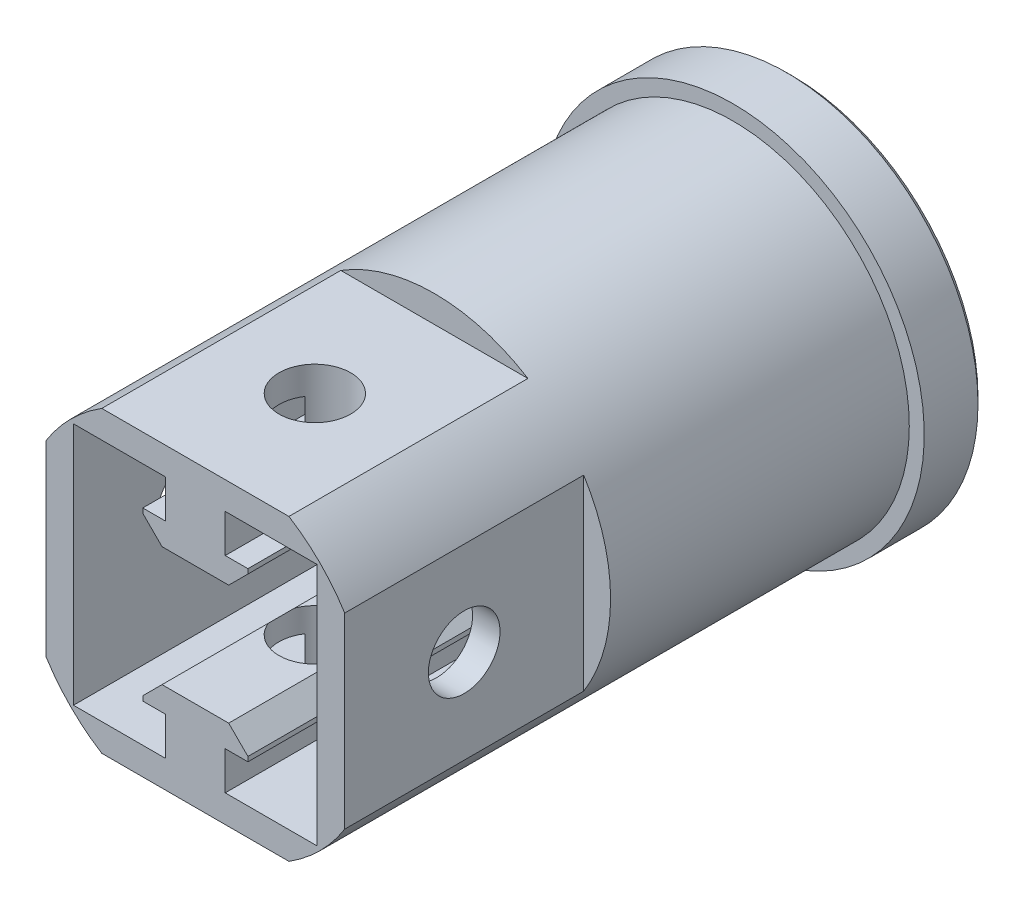
from build123d import *

# Parameters (mm, degrees)
SKETCH1_R           = 14.75
BOSS_EXTRUDE1_DEPTH = 50
SKETCH6_R           = 16
SKETCH6_R_2         = 14.75
BOSS_EXTRUDE4_DEPTH = 5
CUT_EXTRUDE3_DEPTH  = 20
SKETCH8_R           = 3
CUT_EXTRUDE4_DEPTH  = 60.73483071
CHAMFER2_SIZE       = 0.5


with BuildPart() as part:
    # Sketch1 → Boss-Extrude1 (new body)
    with BuildSketch(Plane.XY):
        Circle(SKETCH1_R)
        Polygon((-10.2, 10.2), (-2.5, 10.2), (-2.5, 7), (-4.4, 7), (-4.4, 6.61), (-2.79, 5), (2.79, 5), (4.4, 6.61), (4.4, 7), (2.5, 7), (2.5, 10.2), (10.2, 10.2), (10.2, 2.5), (10.2, -2.5), (10.2, -10.2), (2.5, -10.2), (2.5, -7), (4.4, -7), (4.4, -6.61), (2.79, -5), (-2.79, -5), (-4.4, -6.61), (-4.4, -7), (-2.5, -7), (-2.5, -10.2), (-10.2, -10.2), (-10.2, -2.5), (-10.2, 2.5), align=None, mode=Mode.SUBTRACT)
    extrude(amount=BOSS_EXTRUDE1_DEPTH)

    # Sketch6 → Boss-Extrude4 (add)
    with BuildSketch(Plane(origin=(0, 0, 0), x_dir=(-1, 0, 0), z_dir=(0, 0, -1))):
        Circle(SKETCH6_R)
        Circle(SKETCH6_R_2, mode=Mode.SUBTRACT)
    extrude(amount=-BOSS_EXTRUDE4_DEPTH)

    # Sketch7 → Cut-Extrude3 (cut)
    with BuildSketch(Plane.XY.offset(50)):
        Polygon((0, -12.5), (11.066614126, -12.5), (11.066614126, -16.552961951), (-11.340768707, -16.552961951), (-11.340768707, -12.5), align=None)
        Polygon((-11.340768707, 12.5), (0, 12.5), (11.066614126, 12.5), (11.066614126, 16.552961951), (-11.340768707, 16.552961951), align=None)
        Polygon((12.5, 0), (12.5, 11.066614126), (16.552961951, 11.066614126), (16.552961951, -11.340768707), (12.5, -11.340768707), align=None)
        Polygon((-12.5, -11.340768707), (-12.5, 0), (-12.5, 11.066614126), (-16.552961951, 11.066614126), (-16.552961951, -11.340768707), align=None)
    extrude(amount=-CUT_EXTRUDE3_DEPTH, mode=Mode.SUBTRACT)

    # Sketch8 → Cut-Extrude4 (cut, through all)
    with BuildSketch(Plane.XZ.offset(12.5)):
        with Locations(Location((0, 40, 0), (0, 0, 270))):
            Circle(SKETCH8_R)
    cut_extrude4 = extrude(amount=-CUT_EXTRUDE4_DEPTH, mode=Mode.SUBTRACT)

    # Mirror1: Cut-Extrude4 across plane
    add(cut_extrude4.mirror(Plane(origin=(0, 0, 0), x_dir=(0, 0, 1), z_dir=(0.7071067811865495, -0.7071067811865457, 0))), mode=Mode.SUBTRACT)

    # Chamfer2
    # the kernel refuses this chamfer: 0.5 mm, written as the material it takes off along each edge
    with BuildSketch(Plane(origin=(-5.30922724, 7.51922724, 0), x_dir=(-0.019442520806013736, -0.01944252080601385, 0.9996219169112968), z_dir=(0.7071067811865497, -0.7071067811865455, 0)), Plane(origin=(1.88077276, 4.09077276, 0), x_dir=(0.019442520806013972, -0.01944252080601405, 0.9996219169112968), z_dir=(0.7071067811865489, 0.7071067811865461, 0)), Plane(origin=(5.30922724, -7.51922724, 0), x_dir=(0.019442520806013767, 0.019442520806013813, 0.9996219169112968), z_dir=(-0.7071067811865485, 0.7071067811865467, 0)), Plane(origin=(-1.88077276, -4.09077276, 0), x_dir=(-0.019442520806013986, 0.019442520806014035, 0.9996219169112968), z_dir=(-0.7071067811865485, -0.7071067811865467, 0))) as chamfer2_piece_1:
        Polygon((CHAMFER2_SIZE * 0.999621916911, -CHAMFER2_SIZE * 0.0274958766106), (-CHAMFER2_SIZE * 0.0274958766106, -CHAMFER2_SIZE * 0.999621916911), (0, 0), align=None)
    extrude(amount=4.848566823, mode=Mode.SUBTRACT)
    with BuildSketch(Plane(origin=(-4.075841494, 5, 0), x_dir=(0, 0.9996219169112968, -0.02749587661058639), z_dir=(1, 0, 0)), Plane(origin=(4.075841494, -5, 0), x_dir=(0, -0.9996219169112968, -0.02749587661058639), z_dir=(-1, 0, 0))) as chamfer2_piece_2:
        Polygon((CHAMFER2_SIZE * 0.999621916911, CHAMFER2_SIZE * 0.0274958766106), (-CHAMFER2_SIZE * 0.0274958766106, CHAMFER2_SIZE * 0.999621916911), (0, 0), align=None)
    extrude(amount=8.151682988, mode=Mode.SUBTRACT)
    with BuildSketch(Plane(origin=(5.685841494, 7, 0), x_dir=(0, 0.02749587661058563, 0.9996219169112968), z_dir=(-1, 0, 0)), Plane(origin=(2.5, -7, 0), x_dir=(0, -0.02749587661058563, 0.9996219169112968), z_dir=(1, 0, 0)), Plane(origin=(-5.685841494, -7, 0), x_dir=(0, -0.02749587661058563, 0.9996219169112968), z_dir=(1, 0, 0)), Plane(origin=(-2.5, 7, 0), x_dir=(0, 0.02749587661058563, 0.9996219169112968), z_dir=(-1, 0, 0))) as chamfer2_piece_3:
        Polygon((CHAMFER2_SIZE * 0.999621916911, -CHAMFER2_SIZE * 0.0274958766106), (-CHAMFER2_SIZE * 0.0274958766106, -CHAMFER2_SIZE * 0.999621916911), (0, 0), align=None)
    extrude(amount=3.185841494, mode=Mode.SUBTRACT)
    with BuildSketch(Plane(origin=(2.5, 7, 0), x_dir=(-0.9996219169112968, 2.3583319446590707e-15, -0.027495876610586365), z_dir=(0, 1, 0)), Plane(origin=(2.5, -10.2, 0), x_dir=(-0.9996219169112968, -2.0808811276403563e-15, -0.027495876610586365), z_dir=(0, 1, 0)), Plane(origin=(-2.5, -7, 0), x_dir=(0.9996219169112968, -2.0808811276403563e-15, -0.027495876610586365), z_dir=(0, -1, 0)), Plane(origin=(-2.5, 10.2, 0), x_dir=(0.9996219169112968, -9.19749458417038e-14, -0.027495876610586365), z_dir=(0, -1, 0))) as chamfer2_piece_4:
        Polygon((CHAMFER2_SIZE * 0.999621916911, CHAMFER2_SIZE * 0.0274958766106), (-CHAMFER2_SIZE * 0.0274958766106, CHAMFER2_SIZE * 0.999621916911), (0, 0), align=None)
    extrude(amount=3.2, mode=Mode.SUBTRACT)
    with BuildSketch(Plane(origin=(2.5, 10.2, 0), x_dir=(0, -0.02749587661058563, 0.9996219169112968), z_dir=(1, 0, 0)), Plane(origin=(10.2, -10.2, 0), x_dir=(0, 0.02749587661058563, 0.9996219169112968), z_dir=(-1, 0, 0)), Plane(origin=(-2.5, -10.2, 0), x_dir=(0, 0.02749587661058563, 0.9996219169112968), z_dir=(-1, 0, 0)), Plane(origin=(-10.2, 10.2, 0), x_dir=(0, -0.02749587661058563, 0.9996219169112968), z_dir=(1, 0, 0))) as chamfer2_piece_5:
        Polygon((CHAMFER2_SIZE * 0.999621916911, -CHAMFER2_SIZE * 0.0274958766106), (-CHAMFER2_SIZE * 0.0274958766106, -CHAMFER2_SIZE * 0.999621916911), (0, 0), align=None)
    extrude(amount=7.7, mode=Mode.SUBTRACT)
    with BuildSketch(Plane(origin=(10.2, 10.2, 0), x_dir=(-0.02749587661058563, 0, 0.9996219169112968), z_dir=(0, -1, 0)), Plane(origin=(-10.2, -10.2, 0), x_dir=(0.02749587661058563, 0, 0.9996219169112968), z_dir=(0, 1, 0))) as chamfer2_piece_6:
        Polygon((CHAMFER2_SIZE * 0.999621916911, -CHAMFER2_SIZE * 0.0274958766106), (-CHAMFER2_SIZE * 0.0274958766106, -CHAMFER2_SIZE * 0.999621916911), (0, 0), align=None)
    extrude(amount=20.4, mode=Mode.SUBTRACT)
    with BuildSketch(Plane(origin=(0, 0, 0), x_dir=(-1, 0, 0), z_dir=(0, -1, 0))) as chamfer2_piece_7:
        Polygon((16, -CHAMFER2_SIZE), (16 - CHAMFER2_SIZE, 0), (16, 0), align=None)
    revolve(axis=Axis((0, 0, 0), (0, 0, -1)), mode=Mode.SUBTRACT)
    with BuildSketch(Plane(origin=(5.685841494, 7, 0), x_dir=(0, 0.02749587661058563, 0.9996219169112968), z_dir=(-1, 0, 0))) as chamfer2_piece_8a_section:
        Polygon((CHAMFER2_SIZE * 0.999621916911, -CHAMFER2_SIZE * 0.0274958766106), (-CHAMFER2_SIZE * 0.0274958766106, -CHAMFER2_SIZE * 0.999621916911), (0, 0), align=None)
    chamfer2_piece_8a = extrude(amount=4.471682988, mode=Mode.PRIVATE)
    chamfer2_piece_8a = split(chamfer2_piece_8a, bisect_by=Plane(origin=(2.5, 6.835103187, 0.164896813), z_dir=(-1, 0, 0)), keep=Keep.TOP, mode=Mode.PRIVATE)
    with BuildSketch(Plane(origin=(2.5, 5.714158506, 0), x_dir=(-0.9996219169112968, 2.3583319446590707e-15, -0.027495876610586365), z_dir=(0, 1, 0))) as chamfer2_piece_8b_section:
        Polygon((CHAMFER2_SIZE * 0.999621916911, CHAMFER2_SIZE * 0.0274958766106), (-CHAMFER2_SIZE * 0.0274958766106, CHAMFER2_SIZE * 0.999621916911), (0, 0), align=None)
    chamfer2_piece_8b = extrude(amount=4.485841494, mode=Mode.PRIVATE)
    chamfer2_piece_8b = split(chamfer2_piece_8b, bisect_by=Plane(origin=(2.335103187, 7, 0.164896813), z_dir=(0, -1, 0)), keep=Keep.TOP, mode=Mode.PRIVATE)
    chamfer2_piece_8 = chamfer2_piece_8a & chamfer2_piece_8b
    add(chamfer2_piece_8, mode=Mode.SUBTRACT)
    with BuildSketch(Plane(origin=(1.214158506, 10.2, 0), x_dir=(0, -0.02749587661058563, 0.9996219169112968), z_dir=(1, 0, 0))) as chamfer2_piece_9a_section:
        Polygon((CHAMFER2_SIZE * 0.999621916911, -CHAMFER2_SIZE * 0.0274958766106), (-CHAMFER2_SIZE * 0.0274958766106, -CHAMFER2_SIZE * 0.999621916911), (0, 0), align=None)
    chamfer2_piece_9a = extrude(amount=8.985841494, mode=Mode.PRIVATE)
    chamfer2_piece_9a = split(chamfer2_piece_9a, bisect_by=Plane(origin=(2.5, 10.364896813, 0.164896813), z_dir=(-1, 0, 0)), keep=Keep.TOP, mode=Mode.PRIVATE)
    with BuildSketch(Plane(origin=(2.5, 7, 0), x_dir=(-0.9996219169112968, 2.3583319446590707e-15, -0.027495876610586365), z_dir=(0, 1, 0))) as chamfer2_piece_9b_section:
        Polygon((CHAMFER2_SIZE * 0.999621916911, CHAMFER2_SIZE * 0.0274958766106), (-CHAMFER2_SIZE * 0.0274958766106, CHAMFER2_SIZE * 0.999621916911), (0, 0), align=None)
    chamfer2_piece_9b = extrude(amount=4.485841494, mode=Mode.PRIVATE)
    chamfer2_piece_9b = split(chamfer2_piece_9b, bisect_by=Plane(origin=(2.335103187, 10.2, 0.164896813), z_dir=(0, 1, 0)), keep=Keep.TOP, mode=Mode.PRIVATE)
    chamfer2_piece_9 = chamfer2_piece_9a & chamfer2_piece_9b
    add(chamfer2_piece_9, mode=Mode.SUBTRACT)
    with BuildSketch(Plane(origin=(2.5, 10.2, 0), x_dir=(0, -0.02749587661058563, 0.9996219169112968), z_dir=(1, 0, 0))) as chamfer2_piece_10a_section:
        Polygon((CHAMFER2_SIZE * 0.999621916911, -CHAMFER2_SIZE * 0.0274958766106), (-CHAMFER2_SIZE * 0.0274958766106, -CHAMFER2_SIZE * 0.999621916911), (0, 0), align=None)
    chamfer2_piece_10a = extrude(amount=8.985841494, mode=Mode.PRIVATE)
    chamfer2_piece_10a = split(chamfer2_piece_10a, bisect_by=Plane(origin=(10.2, 10.364896813, 0.164896813), z_dir=(1, 0, 0)), keep=Keep.TOP, mode=Mode.PRIVATE)
    with BuildSketch(Plane(origin=(10.2, 11.485841494, 0), x_dir=(-0.02749587661058563, 0, 0.9996219169112968), z_dir=(0, -1, 0))) as chamfer2_piece_10b_section:
        Polygon((CHAMFER2_SIZE * 0.999621916911, -CHAMFER2_SIZE * 0.0274958766106), (-CHAMFER2_SIZE * 0.0274958766106, -CHAMFER2_SIZE * 0.999621916911), (0, 0), align=None)
    chamfer2_piece_10b = extrude(amount=21.685841494, mode=Mode.PRIVATE)
    chamfer2_piece_10b = split(chamfer2_piece_10b, bisect_by=Plane(origin=(10.364896813, 10.2, 0.164896813), z_dir=(0, 1, 0)), keep=Keep.TOP, mode=Mode.PRIVATE)
    chamfer2_piece_10 = chamfer2_piece_10a & chamfer2_piece_10b
    add(chamfer2_piece_10, mode=Mode.SUBTRACT)
    with BuildSketch(Plane(origin=(10.2, 10.2, 0), x_dir=(-0.02749587661058563, 0, 0.9996219169112968), z_dir=(0, -1, 0))) as chamfer2_piece_11a_section:
        Polygon((CHAMFER2_SIZE * 0.999621916911, -CHAMFER2_SIZE * 0.0274958766106), (-CHAMFER2_SIZE * 0.0274958766106, -CHAMFER2_SIZE * 0.999621916911), (0, 0), align=None)
    chamfer2_piece_11a = extrude(amount=21.685841494, mode=Mode.PRIVATE)
    chamfer2_piece_11a = split(chamfer2_piece_11a, bisect_by=Plane(origin=(10.364896813, -10.2, 0.164896813), z_dir=(0, -1, 0)), keep=Keep.TOP, mode=Mode.PRIVATE)
    with BuildSketch(Plane(origin=(11.485841494, -10.2, 0), x_dir=(0, 0.02749587661058563, 0.9996219169112968), z_dir=(-1, 0, 0))) as chamfer2_piece_11b_section:
        Polygon((CHAMFER2_SIZE * 0.999621916911, -CHAMFER2_SIZE * 0.0274958766106), (-CHAMFER2_SIZE * 0.0274958766106, -CHAMFER2_SIZE * 0.999621916911), (0, 0), align=None)
    chamfer2_piece_11b = extrude(amount=8.985841494, mode=Mode.PRIVATE)
    chamfer2_piece_11b = split(chamfer2_piece_11b, bisect_by=Plane(origin=(10.2, -10.364896813, 0.164896813), z_dir=(1, 0, 0)), keep=Keep.TOP, mode=Mode.PRIVATE)
    chamfer2_piece_11 = chamfer2_piece_11a & chamfer2_piece_11b
    add(chamfer2_piece_11, mode=Mode.SUBTRACT)
    with BuildSketch(Plane(origin=(10.2, -10.2, 0), x_dir=(0, 0.02749587661058563, 0.9996219169112968), z_dir=(-1, 0, 0))) as chamfer2_piece_12a_section:
        Polygon((CHAMFER2_SIZE * 0.999621916911, -CHAMFER2_SIZE * 0.0274958766106), (-CHAMFER2_SIZE * 0.0274958766106, -CHAMFER2_SIZE * 0.999621916911), (0, 0), align=None)
    chamfer2_piece_12a = extrude(amount=8.985841494, mode=Mode.PRIVATE)
    chamfer2_piece_12a = split(chamfer2_piece_12a, bisect_by=Plane(origin=(2.5, -10.364896813, 0.164896813), z_dir=(-1, 0, 0)), keep=Keep.TOP, mode=Mode.PRIVATE)
    with BuildSketch(Plane(origin=(2.5, -11.485841494, 0), x_dir=(-0.9996219169112968, -2.0808811276403563e-15, -0.027495876610586365), z_dir=(0, 1, 0))) as chamfer2_piece_12b_section:
        Polygon((CHAMFER2_SIZE * 0.999621916911, CHAMFER2_SIZE * 0.0274958766106), (-CHAMFER2_SIZE * 0.0274958766106, CHAMFER2_SIZE * 0.999621916911), (0, 0), align=None)
    chamfer2_piece_12b = extrude(amount=4.485841494, mode=Mode.PRIVATE)
    chamfer2_piece_12b = split(chamfer2_piece_12b, bisect_by=Plane(origin=(2.335103187, -10.2, 0.164896813), z_dir=(0, -1, 0)), keep=Keep.TOP, mode=Mode.PRIVATE)
    chamfer2_piece_12 = chamfer2_piece_12a & chamfer2_piece_12b
    add(chamfer2_piece_12, mode=Mode.SUBTRACT)
    with BuildSketch(Plane(origin=(1.214158506, -7, 0), x_dir=(0, -0.02749587661058563, 0.9996219169112968), z_dir=(1, 0, 0))) as chamfer2_piece_13a_section:
        Polygon((CHAMFER2_SIZE * 0.999621916911, -CHAMFER2_SIZE * 0.0274958766106), (-CHAMFER2_SIZE * 0.0274958766106, -CHAMFER2_SIZE * 0.999621916911), (0, 0), align=None)
    chamfer2_piece_13a = extrude(amount=4.471682988, mode=Mode.PRIVATE)
    chamfer2_piece_13a = split(chamfer2_piece_13a, bisect_by=Plane(origin=(2.5, -6.835103187, 0.164896813), z_dir=(-1, 0, 0)), keep=Keep.TOP, mode=Mode.PRIVATE)
    with BuildSketch(Plane(origin=(2.5, -10.2, 0), x_dir=(-0.9996219169112968, -2.0808811276403563e-15, -0.027495876610586365), z_dir=(0, 1, 0))) as chamfer2_piece_13b_section:
        Polygon((CHAMFER2_SIZE * 0.999621916911, CHAMFER2_SIZE * 0.0274958766106), (-CHAMFER2_SIZE * 0.0274958766106, CHAMFER2_SIZE * 0.999621916911), (0, 0), align=None)
    chamfer2_piece_13b = extrude(amount=4.485841494, mode=Mode.PRIVATE)
    chamfer2_piece_13b = split(chamfer2_piece_13b, bisect_by=Plane(origin=(2.335103187, -7, 0.164896813), z_dir=(0, 1, 0)), keep=Keep.TOP, mode=Mode.PRIVATE)
    chamfer2_piece_13 = chamfer2_piece_13a & chamfer2_piece_13b
    add(chamfer2_piece_13, mode=Mode.SUBTRACT)
    with BuildSketch(Plane(origin=(-5.685841494, -7, 0), x_dir=(0, -0.02749587661058563, 0.9996219169112968), z_dir=(1, 0, 0))) as chamfer2_piece_14a_section:
        Polygon((CHAMFER2_SIZE * 0.999621916911, -CHAMFER2_SIZE * 0.0274958766106), (-CHAMFER2_SIZE * 0.0274958766106, -CHAMFER2_SIZE * 0.999621916911), (0, 0), align=None)
    chamfer2_piece_14a = extrude(amount=4.471682988, mode=Mode.PRIVATE)
    chamfer2_piece_14a = split(chamfer2_piece_14a, bisect_by=Plane(origin=(-2.5, -6.835103187, 0.164896813), z_dir=(1, 0, 0)), keep=Keep.TOP, mode=Mode.PRIVATE)
    with BuildSketch(Plane(origin=(-2.5, -5.714158506, 0), x_dir=(0.9996219169112968, -2.0808811276403563e-15, -0.027495876610586365), z_dir=(0, -1, 0))) as chamfer2_piece_14b_section:
        Polygon((CHAMFER2_SIZE * 0.999621916911, CHAMFER2_SIZE * 0.0274958766106), (-CHAMFER2_SIZE * 0.0274958766106, CHAMFER2_SIZE * 0.999621916911), (0, 0), align=None)
    chamfer2_piece_14b = extrude(amount=4.485841494, mode=Mode.PRIVATE)
    chamfer2_piece_14b = split(chamfer2_piece_14b, bisect_by=Plane(origin=(-2.335103187, -7, 0.164896813), z_dir=(0, 1, 0)), keep=Keep.TOP, mode=Mode.PRIVATE)
    chamfer2_piece_14 = chamfer2_piece_14a & chamfer2_piece_14b
    add(chamfer2_piece_14, mode=Mode.SUBTRACT)
    with BuildSketch(Plane(origin=(-1.214158506, -10.2, 0), x_dir=(0, 0.02749587661058563, 0.9996219169112968), z_dir=(-1, 0, 0))) as chamfer2_piece_15a_section:
        Polygon((CHAMFER2_SIZE * 0.999621916911, -CHAMFER2_SIZE * 0.0274958766106), (-CHAMFER2_SIZE * 0.0274958766106, -CHAMFER2_SIZE * 0.999621916911), (0, 0), align=None)
    chamfer2_piece_15a = extrude(amount=8.985841494, mode=Mode.PRIVATE)
    chamfer2_piece_15a = split(chamfer2_piece_15a, bisect_by=Plane(origin=(-2.5, -10.364896813, 0.164896813), z_dir=(1, 0, 0)), keep=Keep.TOP, mode=Mode.PRIVATE)
    with BuildSketch(Plane(origin=(-2.5, -7, 0), x_dir=(0.9996219169112968, -2.0808811276403563e-15, -0.027495876610586365), z_dir=(0, -1, 0))) as chamfer2_piece_15b_section:
        Polygon((CHAMFER2_SIZE * 0.999621916911, CHAMFER2_SIZE * 0.0274958766106), (-CHAMFER2_SIZE * 0.0274958766106, CHAMFER2_SIZE * 0.999621916911), (0, 0), align=None)
    chamfer2_piece_15b = extrude(amount=4.485841494, mode=Mode.PRIVATE)
    chamfer2_piece_15b = split(chamfer2_piece_15b, bisect_by=Plane(origin=(-2.335103187, -10.2, 0.164896813), z_dir=(0, -1, 0)), keep=Keep.TOP, mode=Mode.PRIVATE)
    chamfer2_piece_15 = chamfer2_piece_15a & chamfer2_piece_15b
    add(chamfer2_piece_15, mode=Mode.SUBTRACT)
    with BuildSketch(Plane(origin=(-10.2, -11.485841494, 0), x_dir=(0.02749587661058563, 0, 0.9996219169112968), z_dir=(0, 1, 0))) as chamfer2_piece_16a_section:
        Polygon((CHAMFER2_SIZE * 0.999621916911, -CHAMFER2_SIZE * 0.0274958766106), (-CHAMFER2_SIZE * 0.0274958766106, -CHAMFER2_SIZE * 0.999621916911), (0, 0), align=None)
    chamfer2_piece_16a = extrude(amount=21.685841494, mode=Mode.PRIVATE)
    chamfer2_piece_16a = split(chamfer2_piece_16a, bisect_by=Plane(origin=(-10.364896813, -10.2, 0.164896813), z_dir=(0, -1, 0)), keep=Keep.TOP, mode=Mode.PRIVATE)
    with BuildSketch(Plane(origin=(-2.5, -10.2, 0), x_dir=(0, 0.02749587661058563, 0.9996219169112968), z_dir=(-1, 0, 0))) as chamfer2_piece_16b_section:
        Polygon((CHAMFER2_SIZE * 0.999621916911, -CHAMFER2_SIZE * 0.0274958766106), (-CHAMFER2_SIZE * 0.0274958766106, -CHAMFER2_SIZE * 0.999621916911), (0, 0), align=None)
    chamfer2_piece_16b = extrude(amount=8.985841494, mode=Mode.PRIVATE)
    chamfer2_piece_16b = split(chamfer2_piece_16b, bisect_by=Plane(origin=(-10.2, -10.364896813, 0.164896813), z_dir=(-1, 0, 0)), keep=Keep.TOP, mode=Mode.PRIVATE)
    chamfer2_piece_16 = chamfer2_piece_16a & chamfer2_piece_16b
    add(chamfer2_piece_16, mode=Mode.SUBTRACT)
    with BuildSketch(Plane(origin=(-11.485841494, 10.2, 0), x_dir=(0, -0.02749587661058563, 0.9996219169112968), z_dir=(1, 0, 0))) as chamfer2_piece_17a_section:
        Polygon((CHAMFER2_SIZE * 0.999621916911, -CHAMFER2_SIZE * 0.0274958766106), (-CHAMFER2_SIZE * 0.0274958766106, -CHAMFER2_SIZE * 0.999621916911), (0, 0), align=None)
    chamfer2_piece_17a = extrude(amount=8.985841494, mode=Mode.PRIVATE)
    chamfer2_piece_17a = split(chamfer2_piece_17a, bisect_by=Plane(origin=(-10.2, 10.364896813, 0.164896813), z_dir=(-1, 0, 0)), keep=Keep.TOP, mode=Mode.PRIVATE)
    with BuildSketch(Plane(origin=(-10.2, -10.2, 0), x_dir=(0.02749587661058563, 0, 0.9996219169112968), z_dir=(0, 1, 0))) as chamfer2_piece_17b_section:
        Polygon((CHAMFER2_SIZE * 0.999621916911, -CHAMFER2_SIZE * 0.0274958766106), (-CHAMFER2_SIZE * 0.0274958766106, -CHAMFER2_SIZE * 0.999621916911), (0, 0), align=None)
    chamfer2_piece_17b = extrude(amount=21.685841494, mode=Mode.PRIVATE)
    chamfer2_piece_17b = split(chamfer2_piece_17b, bisect_by=Plane(origin=(-10.364896813, 10.2, 0.164896813), z_dir=(0, 1, 0)), keep=Keep.TOP, mode=Mode.PRIVATE)
    chamfer2_piece_17 = chamfer2_piece_17a & chamfer2_piece_17b
    add(chamfer2_piece_17, mode=Mode.SUBTRACT)
    with BuildSketch(Plane(origin=(-10.2, 10.2, 0), x_dir=(0, -0.02749587661058563, 0.9996219169112968), z_dir=(1, 0, 0))) as chamfer2_piece_18a_section:
        Polygon((CHAMFER2_SIZE * 0.999621916911, -CHAMFER2_SIZE * 0.0274958766106), (-CHAMFER2_SIZE * 0.0274958766106, -CHAMFER2_SIZE * 0.999621916911), (0, 0), align=None)
    chamfer2_piece_18a = extrude(amount=8.985841494, mode=Mode.PRIVATE)
    chamfer2_piece_18a = split(chamfer2_piece_18a, bisect_by=Plane(origin=(-2.5, 10.364896813, 0.164896813), z_dir=(1, 0, 0)), keep=Keep.TOP, mode=Mode.PRIVATE)
    with BuildSketch(Plane(origin=(-2.5, 11.485841494, 0), x_dir=(0.9996219169112968, -9.19749458417038e-14, -0.027495876610586365), z_dir=(0, -1, 0))) as chamfer2_piece_18b_section:
        Polygon((CHAMFER2_SIZE * 0.999621916911, CHAMFER2_SIZE * 0.0274958766106), (-CHAMFER2_SIZE * 0.0274958766106, CHAMFER2_SIZE * 0.999621916911), (0, 0), align=None)
    chamfer2_piece_18b = extrude(amount=4.485841494, mode=Mode.PRIVATE)
    chamfer2_piece_18b = split(chamfer2_piece_18b, bisect_by=Plane(origin=(-2.335103187, 10.2, 0.164896813), z_dir=(0, 1, 0)), keep=Keep.TOP, mode=Mode.PRIVATE)
    chamfer2_piece_18 = chamfer2_piece_18a & chamfer2_piece_18b
    add(chamfer2_piece_18, mode=Mode.SUBTRACT)
    with BuildSketch(Plane(origin=(-1.214158506, 7, 0), x_dir=(0, 0.02749587661058563, 0.9996219169112968), z_dir=(-1, 0, 0))) as chamfer2_piece_19a_section:
        Polygon((CHAMFER2_SIZE * 0.999621916911, -CHAMFER2_SIZE * 0.0274958766106), (-CHAMFER2_SIZE * 0.0274958766106, -CHAMFER2_SIZE * 0.999621916911), (0, 0), align=None)
    chamfer2_piece_19a = extrude(amount=4.471682988, mode=Mode.PRIVATE)
    chamfer2_piece_19a = split(chamfer2_piece_19a, bisect_by=Plane(origin=(-2.5, 6.835103187, 0.164896813), z_dir=(1, 0, 0)), keep=Keep.TOP, mode=Mode.PRIVATE)
    with BuildSketch(Plane(origin=(-2.5, 10.2, 0), x_dir=(0.9996219169112968, -9.19749458417038e-14, -0.027495876610586365), z_dir=(0, -1, 0))) as chamfer2_piece_19b_section:
        Polygon((CHAMFER2_SIZE * 0.999621916911, CHAMFER2_SIZE * 0.0274958766106), (-CHAMFER2_SIZE * 0.0274958766106, CHAMFER2_SIZE * 0.999621916911), (0, 0), align=None)
    chamfer2_piece_19b = extrude(amount=4.485841494, mode=Mode.PRIVATE)
    chamfer2_piece_19b = split(chamfer2_piece_19b, bisect_by=Plane(origin=(-2.335103187, 7, 0.164896813), z_dir=(0, -1, 0)), keep=Keep.TOP, mode=Mode.PRIVATE)
    chamfer2_piece_19 = chamfer2_piece_19a & chamfer2_piece_19b
    add(chamfer2_piece_19, mode=Mode.SUBTRACT)


solid = part.part
